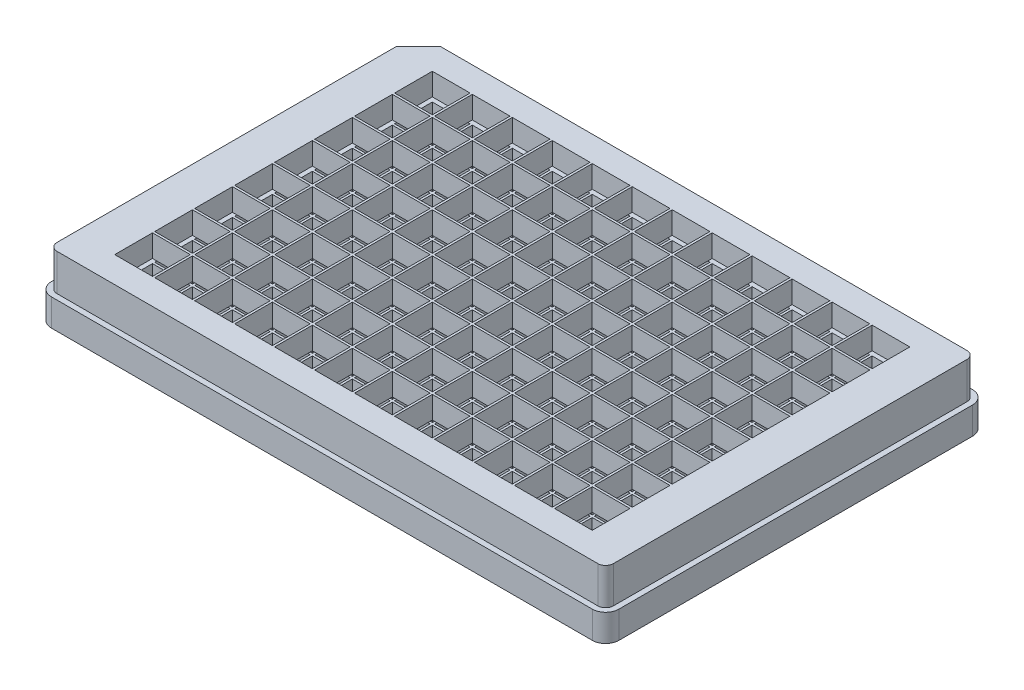
from build123d import *

# Parameters (mm, degrees)
SKETCH1_W           = 127.75
SKETCH1_H           = 85.6
BOSS_EXTRUDE1_DEPTH = 14.35
FILLET1_R           = 3
CUT_FLANGE_DEPTH    = 8.25
SKETCH5_W           = 80.1
SKETCH5_H           = 1
CUT_PAPERSLOT_DEPTH = 123.75
SKETCH4_W           = 8.5
SKETCH4_H           = 8.5
CUT_EXTRUDE1_DEPTH  = 25


with BuildPart() as part:
    # Sketch1 → Boss-Extrude1 (new body)
    with BuildSketch(Plane(origin=(0, 0, 0), x_dir=(1, 0, 0), z_dir=(0, 1, 0))):
        Rectangle(SKETCH1_W, SKETCH1_H)
    extrude(amount=BOSS_EXTRUDE1_DEPTH)

    # Fillet1
    fillet1_edges = [part.edges().sort_by_distance(p)[0] for p in [
        (-63.875, 7.175, -42.8),
        (63.875, 7.175, -42.8),
        (63.875, 7.175, 42.8),
        (-63.875, 7.175, 42.8),
    ]]
    fillet(fillet1_edges, radius=FILLET1_R)

    # Sketch3 → Cut-Flange (cut)
    with BuildSketch(Plane(origin=(0, 14.35, 0), x_dir=(1, 0, 0), z_dir=(0, 1, 0))):
        with BuildLine():
            Line((-63.875, 39.8), (-63.875, -39.8))
            ThreePointArc((-63.875, -39.8), (-62.996320344, -41.921320344), (-60.875, -42.8))
            Line((-60.875, -42.8), (60.875, -42.8))
            ThreePointArc((60.875, -42.8), (62.996320344, -41.921320344), (63.875, -39.8))
            Line((63.875, -39.8), (63.875, 39.8))
            ThreePointArc((63.875, 39.8), (62.996320344, 41.921320344), (60.875, 42.8))
            Line((60.875, 42.8), (-60.875, 42.8))
            ThreePointArc((-60.875, 42.8), (-62.996320344, 41.921320344), (-63.875, 39.8))
        make_face()
        with BuildLine():
            Line((-62.625, 36.600252532), (-62.625, -39.8))
            ThreePointArc((-62.625, -39.8), (-62.112436867, -41.037436867), (-60.875, -41.55))
            Line((-60.875, -41.55), (60.875, -41.55))
            ThreePointArc((60.875, -41.55), (62.112436867, -41.037436867), (62.625, -39.8))
            Line((62.625, -39.8), (62.625, 39.8))
            ThreePointArc((62.625, 39.8), (62.112436867, 41.037436867), (60.875, 41.55))
            Line((60.875, 41.55), (-57.675252532, 41.55))
            Line((-57.675252532, 41.55), (-62.625, 36.600252532))
        make_face(mode=Mode.SUBTRACT)
    extrude(amount=-CUT_FLANGE_DEPTH, mode=Mode.SUBTRACT)

    # Sketch5 → Cut-PaperSlot (cut)
    with BuildSketch(Plane.ZY.offset(62.625)):
        with Locations((0, 8.85)):
            Rectangle(SKETCH5_W, SKETCH5_H)
    extrude(amount=-CUT_PAPERSLOT_DEPTH, mode=Mode.SUBTRACT)

    # Sketch4 → Cut-Extrude1 (cut)
    with BuildSketch(Plane(origin=(0, 14.35, 0), x_dir=(1, 0, 0), z_dir=(0, 1, 0))):
        with Locations((-40.495, 31.56)):
            Rectangle(SKETCH4_W, SKETCH4_H)
        with Locations((-49.495, 31.56)):
            Rectangle(SKETCH4_W, SKETCH4_H)
        with Locations((-31.495, 31.56)):
            Rectangle(SKETCH4_W, SKETCH4_H)
        with Locations((-22.495, 31.56)):
            Rectangle(SKETCH4_W, SKETCH4_H)
        with Locations((-13.495, 31.56)):
            Rectangle(SKETCH4_W, SKETCH4_H)
        with Locations((-4.495, 31.56)):
            Rectangle(SKETCH4_W, SKETCH4_H)
        with Locations((4.505, 31.56)):
            Rectangle(SKETCH4_W, SKETCH4_H)
        with Locations((13.505, 31.56)):
            Rectangle(SKETCH4_W, SKETCH4_H)
        with Locations((22.505, 31.56)):
            Rectangle(SKETCH4_W, SKETCH4_H)
        with Locations((31.505, 31.56)):
            Rectangle(SKETCH4_W, SKETCH4_H)
        with Locations((40.505, 31.56)):
            Rectangle(SKETCH4_W, SKETCH4_H)
        with Locations((49.505, 31.56)):
            Rectangle(SKETCH4_W, SKETCH4_H)
        with Locations((-40.495, 22.56)):
            Rectangle(SKETCH4_W, SKETCH4_H)
        with Locations((-31.495, 22.56)):
            Rectangle(SKETCH4_W, SKETCH4_H)
        with Locations((-22.495, 22.56)):
            Rectangle(SKETCH4_W, SKETCH4_H)
        with Locations((-13.495, 22.56)):
            Rectangle(SKETCH4_W, SKETCH4_H)
        with Locations((-4.495, 22.56)):
            Rectangle(SKETCH4_W, SKETCH4_H)
        with Locations((4.505, 22.56)):
            Rectangle(SKETCH4_W, SKETCH4_H)
        with Locations((13.505, 22.56)):
            Rectangle(SKETCH4_W, SKETCH4_H)
        with Locations((22.505, 22.56)):
            Rectangle(SKETCH4_W, SKETCH4_H)
        with Locations((31.505, 22.56)):
            Rectangle(SKETCH4_W, SKETCH4_H)
        with Locations((40.505, 22.56)):
            Rectangle(SKETCH4_W, SKETCH4_H)
        with Locations((49.505, 22.56)):
            Rectangle(SKETCH4_W, SKETCH4_H)
        with Locations((-40.495, 13.56)):
            Rectangle(SKETCH4_W, SKETCH4_H)
        with Locations((-31.495, 13.56)):
            Rectangle(SKETCH4_W, SKETCH4_H)
        with Locations((-22.495, 13.56)):
            Rectangle(SKETCH4_W, SKETCH4_H)
        with Locations((-13.495, 13.56)):
            Rectangle(SKETCH4_W, SKETCH4_H)
        with Locations((-4.495, 13.56)):
            Rectangle(SKETCH4_W, SKETCH4_H)
        with Locations((4.505, 13.56)):
            Rectangle(SKETCH4_W, SKETCH4_H)
        with Locations((13.505, 13.56)):
            Rectangle(SKETCH4_W, SKETCH4_H)
        with Locations((22.505, 13.56)):
            Rectangle(SKETCH4_W, SKETCH4_H)
        with Locations((31.505, 13.56)):
            Rectangle(SKETCH4_W, SKETCH4_H)
        with Locations((40.505, 13.56)):
            Rectangle(SKETCH4_W, SKETCH4_H)
        with Locations((49.505, 13.56)):
            Rectangle(SKETCH4_W, SKETCH4_H)
        with Locations((-40.495, 4.56)):
            Rectangle(SKETCH4_W, SKETCH4_H)
        with Locations((-31.495, 4.56)):
            Rectangle(SKETCH4_W, SKETCH4_H)
        with Locations((-22.495, 4.56)):
            Rectangle(SKETCH4_W, SKETCH4_H)
        with Locations((-13.495, 4.56)):
            Rectangle(SKETCH4_W, SKETCH4_H)
        with Locations((-4.495, 4.56)):
            Rectangle(SKETCH4_W, SKETCH4_H)
        with Locations((4.505, 4.56)):
            Rectangle(SKETCH4_W, SKETCH4_H)
        with Locations((13.505, 4.56)):
            Rectangle(SKETCH4_W, SKETCH4_H)
        with Locations((22.505, 4.56)):
            Rectangle(SKETCH4_W, SKETCH4_H)
        with Locations((31.505, 4.56)):
            Rectangle(SKETCH4_W, SKETCH4_H)
        with Locations((40.505, 4.56)):
            Rectangle(SKETCH4_W, SKETCH4_H)
        with Locations((49.505, 4.56)):
            Rectangle(SKETCH4_W, SKETCH4_H)
        with Locations((-40.495, -4.44)):
            Rectangle(SKETCH4_W, SKETCH4_H)
        with Locations((-31.495, -4.44)):
            Rectangle(SKETCH4_W, SKETCH4_H)
        with Locations((-22.495, -4.44)):
            Rectangle(SKETCH4_W, SKETCH4_H)
        with Locations((-13.495, -4.44)):
            Rectangle(SKETCH4_W, SKETCH4_H)
        with Locations((-4.495, -4.44)):
            Rectangle(SKETCH4_W, SKETCH4_H)
        with Locations((4.505, -4.44)):
            Rectangle(SKETCH4_W, SKETCH4_H)
        with Locations((13.505, -4.44)):
            Rectangle(SKETCH4_W, SKETCH4_H)
        with Locations((22.505, -4.44)):
            Rectangle(SKETCH4_W, SKETCH4_H)
        with Locations((31.505, -4.44)):
            Rectangle(SKETCH4_W, SKETCH4_H)
        with Locations((40.505, -4.44)):
            Rectangle(SKETCH4_W, SKETCH4_H)
        with Locations((49.505, -4.44)):
            Rectangle(SKETCH4_W, SKETCH4_H)
        with Locations((-40.495, -13.44)):
            Rectangle(SKETCH4_W, SKETCH4_H)
        with Locations((-31.495, -13.44)):
            Rectangle(SKETCH4_W, SKETCH4_H)
        with Locations((-22.495, -13.44)):
            Rectangle(SKETCH4_W, SKETCH4_H)
        with Locations((-13.495, -13.44)):
            Rectangle(SKETCH4_W, SKETCH4_H)
        with Locations((-4.495, -13.44)):
            Rectangle(SKETCH4_W, SKETCH4_H)
        with Locations((4.505, -13.44)):
            Rectangle(SKETCH4_W, SKETCH4_H)
        with Locations((13.505, -13.44)):
            Rectangle(SKETCH4_W, SKETCH4_H)
        with Locations((22.505, -13.44)):
            Rectangle(SKETCH4_W, SKETCH4_H)
        with Locations((31.505, -13.44)):
            Rectangle(SKETCH4_W, SKETCH4_H)
        with Locations((40.505, -13.44)):
            Rectangle(SKETCH4_W, SKETCH4_H)
        with Locations((49.505, -13.44)):
            Rectangle(SKETCH4_W, SKETCH4_H)
        with Locations((-40.495, -22.44)):
            Rectangle(SKETCH4_W, SKETCH4_H)
        with Locations((-31.495, -22.44)):
            Rectangle(SKETCH4_W, SKETCH4_H)
        with Locations((-22.495, -22.44)):
            Rectangle(SKETCH4_W, SKETCH4_H)
        with Locations((-13.495, -22.44)):
            Rectangle(SKETCH4_W, SKETCH4_H)
        with Locations((-4.495, -22.44)):
            Rectangle(SKETCH4_W, SKETCH4_H)
        with Locations((4.505, -22.44)):
            Rectangle(SKETCH4_W, SKETCH4_H)
        with Locations((13.505, -22.44)):
            Rectangle(SKETCH4_W, SKETCH4_H)
        with Locations((22.505, -22.44)):
            Rectangle(SKETCH4_W, SKETCH4_H)
        with Locations((31.505, -22.44)):
            Rectangle(SKETCH4_W, SKETCH4_H)
        with Locations((40.505, -22.44)):
            Rectangle(SKETCH4_W, SKETCH4_H)
        with Locations((49.505, -22.44)):
            Rectangle(SKETCH4_W, SKETCH4_H)
        with Locations((-40.495, -31.44)):
            Rectangle(SKETCH4_W, SKETCH4_H)
        with Locations((-31.495, -31.44)):
            Rectangle(SKETCH4_W, SKETCH4_H)
        with Locations((-22.495, -31.44)):
            Rectangle(SKETCH4_W, SKETCH4_H)
        with Locations((-13.495, -31.44)):
            Rectangle(SKETCH4_W, SKETCH4_H)
        with Locations((-4.495, -31.44)):
            Rectangle(SKETCH4_W, SKETCH4_H)
        with Locations((4.505, -31.44)):
            Rectangle(SKETCH4_W, SKETCH4_H)
        with Locations((13.505, -31.44)):
            Rectangle(SKETCH4_W, SKETCH4_H)
        with Locations((22.505, -31.44)):
            Rectangle(SKETCH4_W, SKETCH4_H)
        with Locations((31.505, -31.44)):
            Rectangle(SKETCH4_W, SKETCH4_H)
        with Locations((40.505, -31.44)):
            Rectangle(SKETCH4_W, SKETCH4_H)
        with Locations((49.505, -31.44)):
            Rectangle(SKETCH4_W, SKETCH4_H)
        with Locations((-49.495, 22.56)):
            Rectangle(SKETCH4_W, SKETCH4_H)
        with Locations((-49.495, 13.56)):
            Rectangle(SKETCH4_W, SKETCH4_H)
        with Locations((-49.495, 4.56)):
            Rectangle(SKETCH4_W, SKETCH4_H)
        with Locations((-49.495, -4.44)):
            Rectangle(SKETCH4_W, SKETCH4_H)
        with Locations((-49.495, -13.44)):
            Rectangle(SKETCH4_W, SKETCH4_H)
        with Locations((-49.495, -22.44)):
            Rectangle(SKETCH4_W, SKETCH4_H)
        with Locations((-49.495, -31.44)):
            Rectangle(SKETCH4_W, SKETCH4_H)
    extrude(amount=-CUT_EXTRUDE1_DEPTH, mode=Mode.SUBTRACT)


solid = part.part
